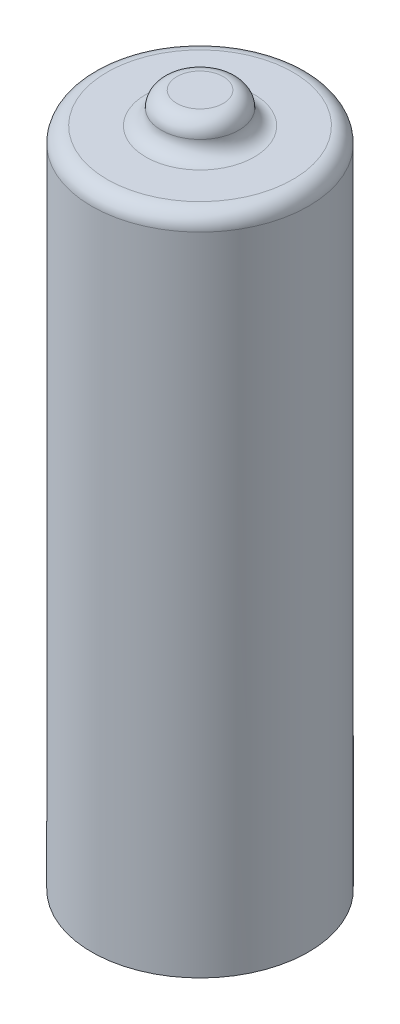
from build123d import *

# Parameters (mm, degrees)
SKETCH1_R                       = 7
BOSS_EXTRUDE1_DEPTH             = 42.7
SKETCH3_R                       = 6
CUT_EXTRUDE1_DEPTH              = 1
SKETCH2_R                       = 2.5
BOSS_EXTRUDE2_DEPTH             = 2
BOSS_EXTRUDE2_DIRECTION_2_REACH = 45.833
FILLET2_R                       = 1
FILLET4_R                       = 1


with BuildPart() as part:
    # Sketch1 → Boss-Extrude1 (new body)
    with BuildSketch(Plane(origin=(0, 0, 0), x_dir=(1, 0, 0), z_dir=(0, 1, 0))):
        with Locations(Location((0, 0, 0), (0, 0, 90))):
            Circle(SKETCH1_R)
    extrude(amount=BOSS_EXTRUDE1_DEPTH)

    # Sketch3 → Cut-Extrude1 (cut)
    with BuildSketch(Plane.XZ):
        with Locations(Location((0, 0, 0), (0, 0, 270))):
            Circle(SKETCH3_R)
    extrude(amount=-CUT_EXTRUDE1_DEPTH, mode=Mode.SUBTRACT)

    # Sketch2 → Boss-Extrude2 (add)
    with BuildSketch(Plane(origin=(0, 42.7, 0), x_dir=(1, 0, 0), z_dir=(0, 1, 0))):
        with Locations(Location((0, 0, 0), (0, 0, 270))):
            Circle(SKETCH2_R)
    extrude(amount=BOSS_EXTRUDE2_DEPTH)

    # Boss-Extrude2 direction 2: up to this face of the body (flat: up to its plane)
    boss_extrude2_direction_2_end = Plane(part.part.faces().sort_by_distance((0, 0, 6.802010101))[0])
    # Sketch2 → Boss-Extrude2 direction 2 (add, up to the picked face)
    with BuildSketch(Plane(origin=(0, 42.7, 0), x_dir=(1, 0, 0), z_dir=(0, 1, 0)), mode=Mode.PRIVATE) as boss_extrude2_direction_2_sk1:
        with Locations(Location((0, 0, 0), (0, 0, 270))):
            Circle(SKETCH2_R)
    boss_extrude2_direction_2_tool1 = split(extrude(boss_extrude2_direction_2_sk1.sketch, amount=-BOSS_EXTRUDE2_DIRECTION_2_REACH, mode=Mode.PRIVATE), bisect_by=boss_extrude2_direction_2_end, keep=Keep.BOTH, mode=Mode.PRIVATE)
    add(boss_extrude2_direction_2_tool1.solids().sort_by(Axis((0, 42.7, 0), (0, -1, 0)))[0])

    # Fillet2
    fillet2_edges = [part.edges().sort_by_distance(p)[0] for p in [
        (0, 1, -2.5),
    ]]
    fillet(fillet2_edges, radius=FILLET2_R - 0.0001)  # a hair under: the kernel refuses the full size

    # Fillet4
    fillet4_edges = [part.edges().sort_by_distance(p)[0] for p in [
        (0, 42.7, -2.5),
        (0, 44.7, -2.5),
        (0, 42.7, 7),
    ]]
    fillet(fillet4_edges, radius=FILLET4_R - 0.0001)  # a hair under: the kernel refuses the full size


solid = part.part
